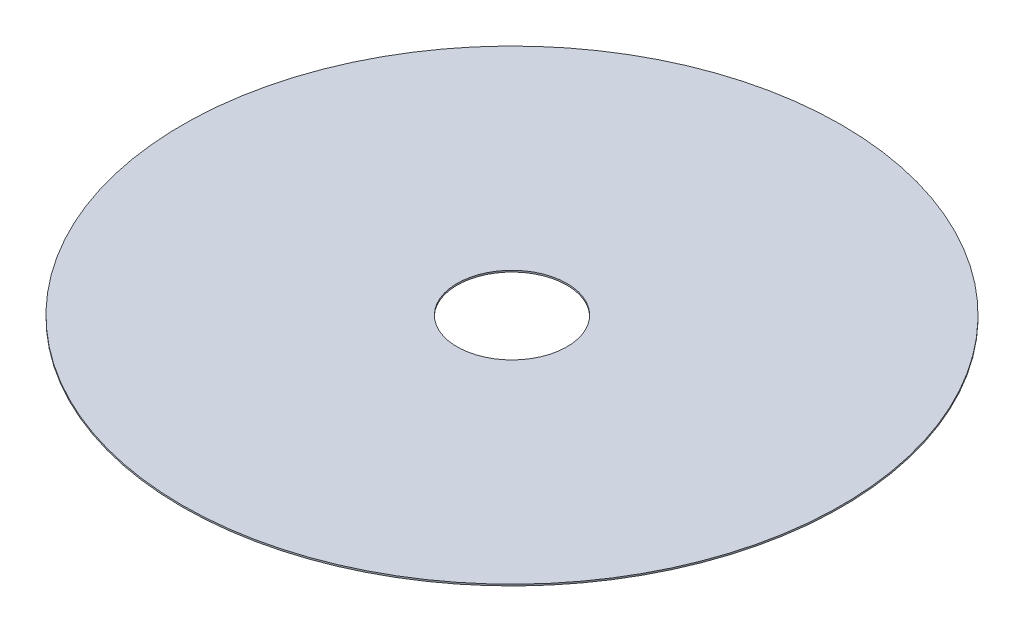
from build123d import *

# Parameters (mm, degrees)
SKETCH1_W = 1250
SKETCH1_H = 7


with BuildPart() as part:
    # Sketch1 → Revolve1 (revolve)
    with BuildSketch(Plane.XY):
        with Locations((875, 0)):
            Rectangle(SKETCH1_W, SKETCH1_H)
    revolve(axis=Axis((0, 0, 0), (0, 1, 0)))


solid = part.part
